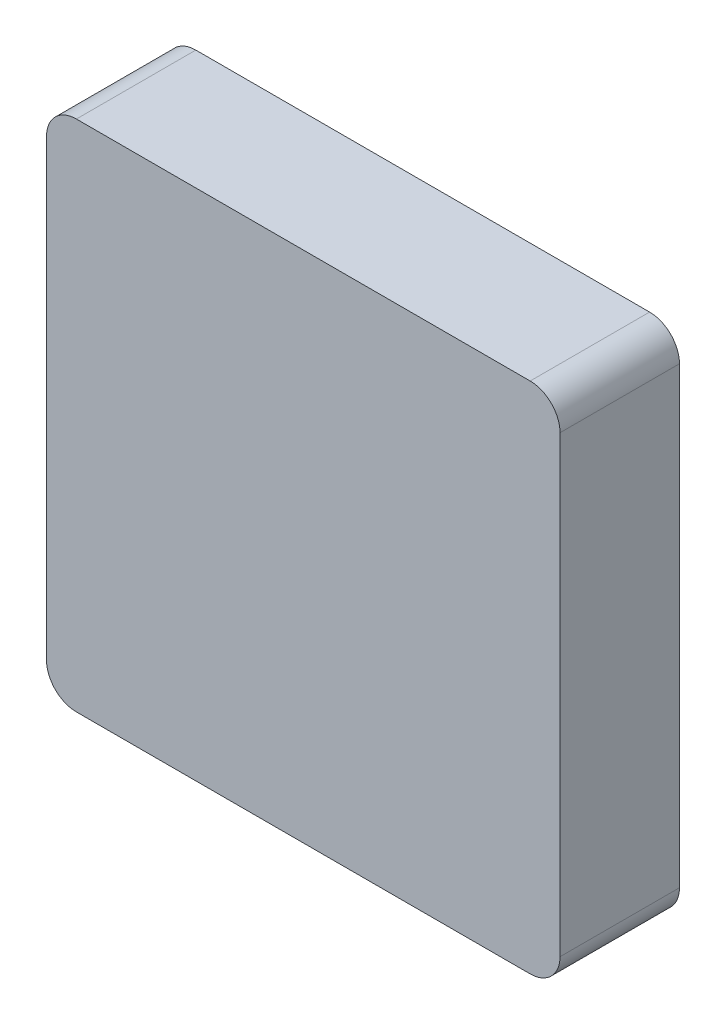
from build123d import *

# Parameters (mm, degrees)
BOSS_EXTRUDE1_OUTLINE_W = 43.688
BOSS_EXTRUDE1_OUTLINE_H = 43.688
BOSS_EXTRUDE1_DEPTH     = 10.16
CUT_EXTRUDE2_DEPTH      = 9.398
SKETCH3_W               = 2.4
SKETCH3_H               = 3.4
CUT_EXTRUDE3_DEPTH      = 9.398
FILLET1_R               = 2.54
FILLET2_R               = 2.54


# Read off the part's stored shape, not the designer's step: Boss-Extrude1
with BuildPart() as part:
    # Boss-Extrude1 outline → Boss-Extrude1 (new body)
    with BuildSketch(Plane.XY):
        Rectangle(BOSS_EXTRUDE1_OUTLINE_W, BOSS_EXTRUDE1_OUTLINE_H)
    extrude(amount=BOSS_EXTRUDE1_DEPTH)

    # Sketch4 → Cut-Extrude2 (cut)
    with BuildSketch(Plane(origin=(0, 0, 0), x_dir=(-1, 0, 0), z_dir=(0, 0, -1))):
        Polygon((-19.304, 19.304), (0, 0), (19.304, 19.304), align=None)
        Polygon((-19.304, 19.304), (-19.304, -19.304), (0, 0), align=None)
        Polygon((19.304, 19.304), (0, 0), (19.304, -19.304), align=None)
        Polygon((0, 0), (-19.304, -19.304), (19.304, -19.304), align=None)
    extrude(amount=-CUT_EXTRUDE2_DEPTH, mode=Mode.SUBTRACT)

    # Sketch3 → Cut-Extrude3 (cut)
    with BuildSketch(Plane.XZ.offset(21.844)):
        with Locations((0, 1.7)):
            Rectangle(SKETCH3_W, SKETCH3_H)
    extrude(amount=-CUT_EXTRUDE3_DEPTH, mode=Mode.SUBTRACT)

    # Fillet1
    fillet1_edges = [part.edges().sort_by_distance(p)[0] for p in [
        (21.844, -21.844, 5.08),
        (-21.844, -21.844, 5.08),
        (-21.844, 21.844, 5.08),
        (21.844, 21.844, 5.08),
    ]]
    fillet(fillet1_edges, radius=FILLET1_R)

    # Fillet2
    fillet2_edges = [part.edges().sort_by_distance(p)[0] for p in [
        (19.304, 19.304, 4.699),
        (-19.304, 19.304, 4.699),
        (-19.304, -19.304, 4.699),
        (19.304, -19.304, 4.699),
    ]]
    fillet(fillet2_edges, radius=FILLET2_R)


solid = part.part
